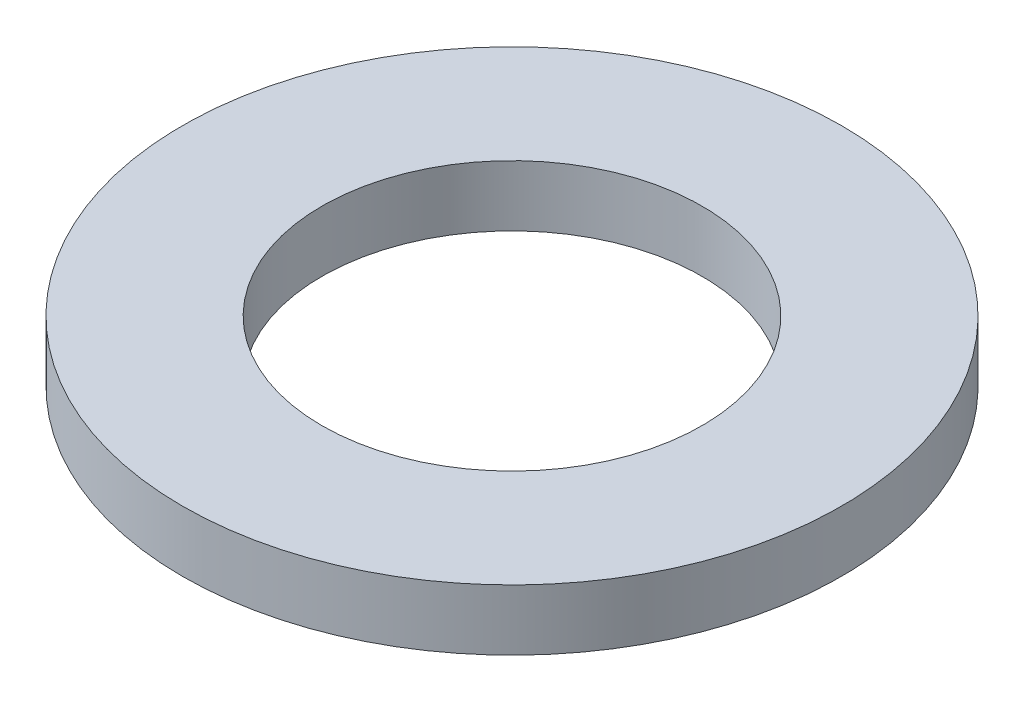
from build123d import *

# Parameters (mm, degrees)
SKETCH1_R           = 65
BOSS_EXTRUDE1_DEPTH = 12
SKETCH2_R           = 37.5
CUT_EXTRUDE1_DEPTH  = 93.703829479


with BuildPart() as part:
    # Sketch1 → Boss-Extrude1 (new body)
    with BuildSketch(Plane(origin=(0, 0, 0), x_dir=(1, 0, 0), z_dir=(0, 1, 0))):
        Circle(SKETCH1_R)
    extrude(amount=BOSS_EXTRUDE1_DEPTH)

    # Sketch2 → Cut-Extrude1 (cut, through all)
    with BuildSketch(Plane(origin=(0, 0, 0), x_dir=(1, 0, 0), z_dir=(0, 1, 0))):
        Circle(SKETCH2_R)
    extrude(amount=CUT_EXTRUDE1_DEPTH, mode=Mode.SUBTRACT)


solid = part.part
